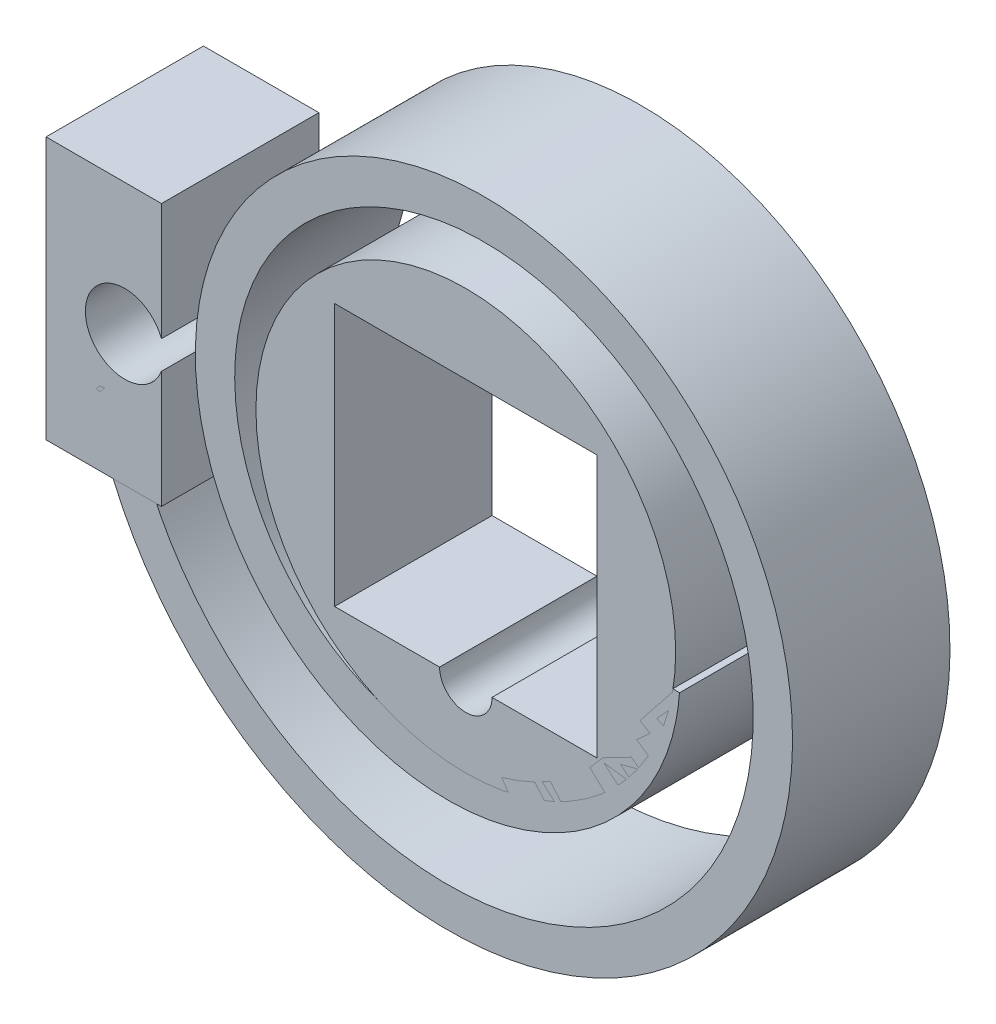
from build123d import *

# Parameters (mm, degrees)
ESQUISSE1_R          = 8
BOSS_EXTRU_1_DEPTH   = 6
BOSS_EXTRU_1_2_DEPTH = 6
BALAYAGE2_DEPTH      = 6


# Read off the part's stored shape, not the designer's step: Balayage2
with BuildPart() as part:
    # Esquisse1 → Boss.-Extru.1 (new body)
    with BuildSketch(Plane.XY):
        with Locations((13, 0)):
            Circle(ESQUISSE1_R)
        with BuildLine():
            Line((8, 5), (18, 5))
            Line((18, 5), (18, -5))
            Line((18, -5), (14, -5))
            ThreePointArc((14, -5), (13, -6), (12, -5))
            Line((12, -5), (8, -5))
            Line((8, -5), (8, 5))
        make_face(mode=Mode.SUBTRACT)
    extrude(amount=BOSS_EXTRU_1_DEPTH)


with BuildPart() as body_2:
    # Esquisse1 → Boss.-Extru.1 2 (new body)
    with BuildSketch(Plane.XY):
        with BuildLine():
            Line((1.4, -0.538516481), (1.4, -5))
            Line((1.4, -5), (-3, -5))
            Line((-3, -5), (-3, 5))
            Line((-3, 5), (1.4, 5))
            Line((1.4, 5), (1.4, 0.538516481))
            ThreePointArc((1.4, 0.538516481), (-1.5, 0), (1.4, -0.538516481))
        make_face()
    extrude(amount=BOSS_EXTRU_1_2_DEPTH)


with BuildPart() as body_3:
    # Balayage2 outline → Balayage2 (new body)
    with BuildSketch(Plane.XY):
        with BuildLine():
            add(Edge.make_bspline(
                [(0.164032959, -1.944613303), (0.506396871, -3.607917309), (1.179264256, -5.191157109), (3.047673522, -7.942626067), (4.250737694, -9.121734152), (6.972663129, -10.907763689), (8.502712432, -11.521923081), (11.632391284, -12.114400381), (13.245160201, -12.095116805), (16.293911252, -11.456313422), (17.742978472, -10.833961583), (20.255462917, -9.114280759), (21.329903585, -8.009298257), (22.952106044, -5.516275925), (23.507128331, -4.116911793), (24.03591202, -1.261425329), (24.012038287, 0.207972321), (23.419390884, 2.979035431), (22.847699176, 4.293899166), (21.276995762, 6.567533081), (20.270204714, 7.537397657), (18.006276178, 8.996005989), (16.737668249, 9.492025714), (14.15646747, 9.957422926), (12.830456425, 9.929120623), (10.337048374, 9.382970361), (9.156337469, 8.862104635), (7.121382564, 7.440702529), (6.25597634, 6.532246348), (4.960660127, 4.497662357), (4.523467736, 3.359904651), (4.121054986, 1.053114865), (4.153573493, -0.129487918), (4.652775889, -2.345280923), (5.122595608, -3.391904446), (6.394264145, -5.188404917), (7.204193135, -5.949508251), (9.00909367, -7.081933797), (10.015873084, -7.46053305), (12.048078293, -7.800501926), (13.08724114, -7.764054172), (15.025467999, -7.31241257), (15.93809075, -6.893939546), (17.496438918, -5.77259963), (18.153450642, -5.061464122), (19.123535686, -3.486720775), (19.443864865, -2.611100331), (19.610830691, -1.556677813), (19.631493768, -1.380261161), (19.645132136, -1.203823372)],
                knots=[0, 0, 0, 0, 0.03125, 0.03125, 0.0625, 0.0625, 0.09375, 0.09375, 0.125, 0.125, 0.15625, 0.15625, 0.1875, 0.1875, 0.21875, 0.21875, 0.25, 0.25, 0.28125, 0.28125, 0.3125, 0.3125, 0.34375, 0.34375, 0.375, 0.375, 0.40625, 0.40625, 0.4375, 0.4375, 0.46875, 0.46875, 0.5, 0.5, 0.53125, 0.53125, 0.5625, 0.5625, 0.59375, 0.59375, 0.625, 0.625, 0.65625, 0.65625, 0.6875, 0.6875, 0.71875, 0.71875, 0.725, 0.725, 0.725, 0.725], degree=3))
            Line((0.164032959, -1.944613303), (-1.29716185, -2.28359668))
            add(Edge.make_bspline(
                [(-1.29716185, -2.28359668), (-0.90977771, -4.140961303), (-0.156255725, -5.902570174), (1.944261379, -8.978098829), (3.290191193, -10.290956062), (6.350794548, -12.287259596), (8.064099774, -12.97014824), (11.58724489, -13.626914518), (13.395634143, -13.600806998), (16.832451461, -12.870427931), (18.459572331, -12.166720864), (21.295331058, -10.21356614), (22.503000825, -8.965125738), (24.334178971, -6.132423448), (24.957194652, -4.549440195), (25.548618925, -1.300038958), (25.517068059, 0.3650361), (24.831078099, 3.523941749), (24.177186004, 5.016574488), (22.371393659, 7.612563288), (21.220442669, 8.715045588), (18.615641443, 10.381098348), (17.162980163, 10.944241063), (14.187322806, 11.470323333), (12.665561943, 11.433329119), (9.784567964, 10.791728267), (8.426423355, 10.187651143), (6.070204482, 8.529221179), (5.072909649, 7.475759599), (3.571982276, 5.09885944), (3.068712527, 3.776520132), (2.607972259, 1.074606654), (2.650409821, -0.303840013), (3.247621563, -2.906922324), (3.801883719, -4.130578802), (5.312951301, -6.247027749), (6.268923471, -7.139135113), (8.417922564, -8.474937102), (9.6099399, -8.918333882), (12.038109497, -9.313732151), (13.27324197, -9.265851237), (15.598412611, -8.713028607), (16.687580958, -8.208581419), (18.56425998, -6.84487622), (19.351179873, -5.986393458), (20.52185648, -4.065295434), (20.90538029, -3.003600068), (21.103414053, -1.710944638), (21.127685584, -1.49491785), (21.143362698, -1.278969198)],
                knots=[0, 0, 0, 0, 0.03125, 0.03125, 0.0625, 0.0625, 0.09375, 0.09375, 0.125, 0.125, 0.15625, 0.15625, 0.1875, 0.1875, 0.21875, 0.21875, 0.25, 0.25, 0.28125, 0.28125, 0.3125, 0.3125, 0.34375, 0.34375, 0.375, 0.375, 0.40625, 0.40625, 0.4375, 0.4375, 0.46875, 0.46875, 0.5, 0.5, 0.53125, 0.53125, 0.5625, 0.5625, 0.59375, 0.59375, 0.625, 0.625, 0.65625, 0.65625, 0.6875, 0.6875, 0.71875, 0.71875, 0.725, 0.725, 0.725, 0.725], degree=3))
            Line((21.143362698, -1.278969198), (19.645132136, -1.203823372))
        make_face()
    extrude(amount=BALAYAGE2_DEPTH)


solid = Compound([part.part, body_2.part, body_3.part])
